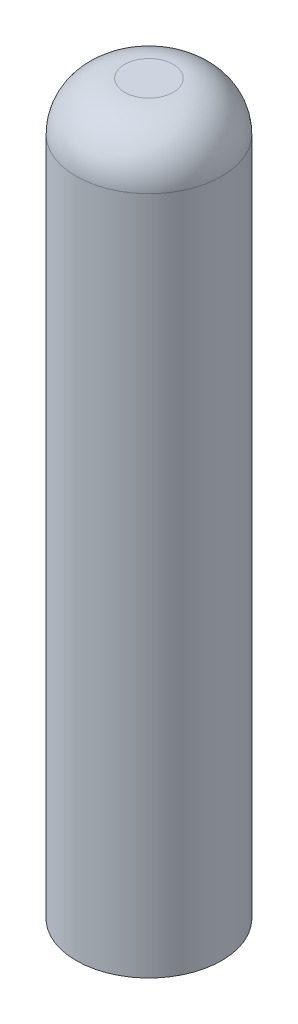
from build123d import *

# Parameters (mm, degrees)
SKETCH1_R           = 1.5
BOSS_EXTRUDE1_DEPTH = 15
FILLET1_R           = 1


with BuildPart() as part:
    # Sketch1 → Boss-Extrude1 (new body)
    with BuildSketch(Plane(origin=(0, 0, 0), x_dir=(1, 0, 0), z_dir=(0, 1, 0))):
        Circle(SKETCH1_R)
    extrude(amount=BOSS_EXTRUDE1_DEPTH)

    # Fillet1
    fillet1_edges = [part.edges().sort_by_distance(p)[0] for p in [
        (-1.5, 15, 0),
    ]]
    fillet(fillet1_edges, radius=FILLET1_R)


solid = part.part
